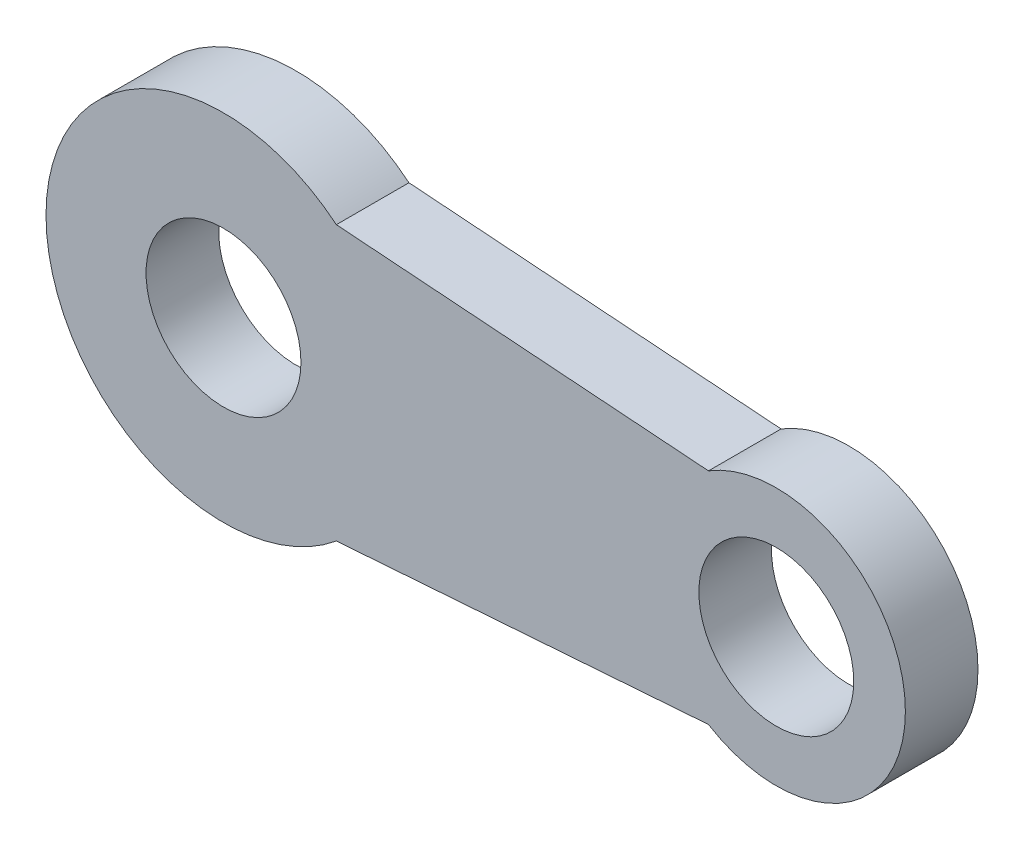
from build123d import *

# Parameters (mm, degrees)
SKETCH1_R           = 11
BOSS_EXTRUDE1_DEPTH = 2.25
SKETCH2_R           = 8
BOSS_EXTRUDE2_DEPTH = 2.25
BOSS_EXTRUDE3_DEPTH = 2.25
SKETCH4_R           = 4.8
CUT_EXTRUDE1_DEPTH  = 4.5


with BuildPart() as part:
    # Sketch1 → Boss-Extrude1 (new, symmetric)
    with BuildSketch(Plane.XY):
        Circle(SKETCH1_R)
    extrude(amount=BOSS_EXTRUDE1_DEPTH, both=True)



with BuildPart() as body_2:
    # Sketch2 → Boss-Extrude2 (new, symmetric)
    with BuildSketch(Plane.XY):
        with Locations((34.26, 0)):
            Circle(SKETCH2_R)
    extrude(amount=BOSS_EXTRUDE2_DEPTH, both=True)


with BuildPart() as part_1:
    add(part.part)

    add(body_2.part)  # Boss-Extrude3 merges body 2
    # Sketch3 → Boss-Extrude3 (add, symmetric)
    with BuildSketch(Plane.XY):
        Polygon((0, -9), (34.26, -6.5), (34.26, 6.5), (0, 9), align=None)
    extrude(amount=BOSS_EXTRUDE3_DEPTH, both=True)

    # Sketch4 → Cut-Extrude1 (cut, symmetric)
    with BuildSketch(Plane.XY):
        Circle(SKETCH4_R)
        with Locations((34.26, 0)):
            Circle(SKETCH4_R)
    extrude(amount=CUT_EXTRUDE1_DEPTH, both=True, mode=Mode.SUBTRACT)


solid = part_1.part
